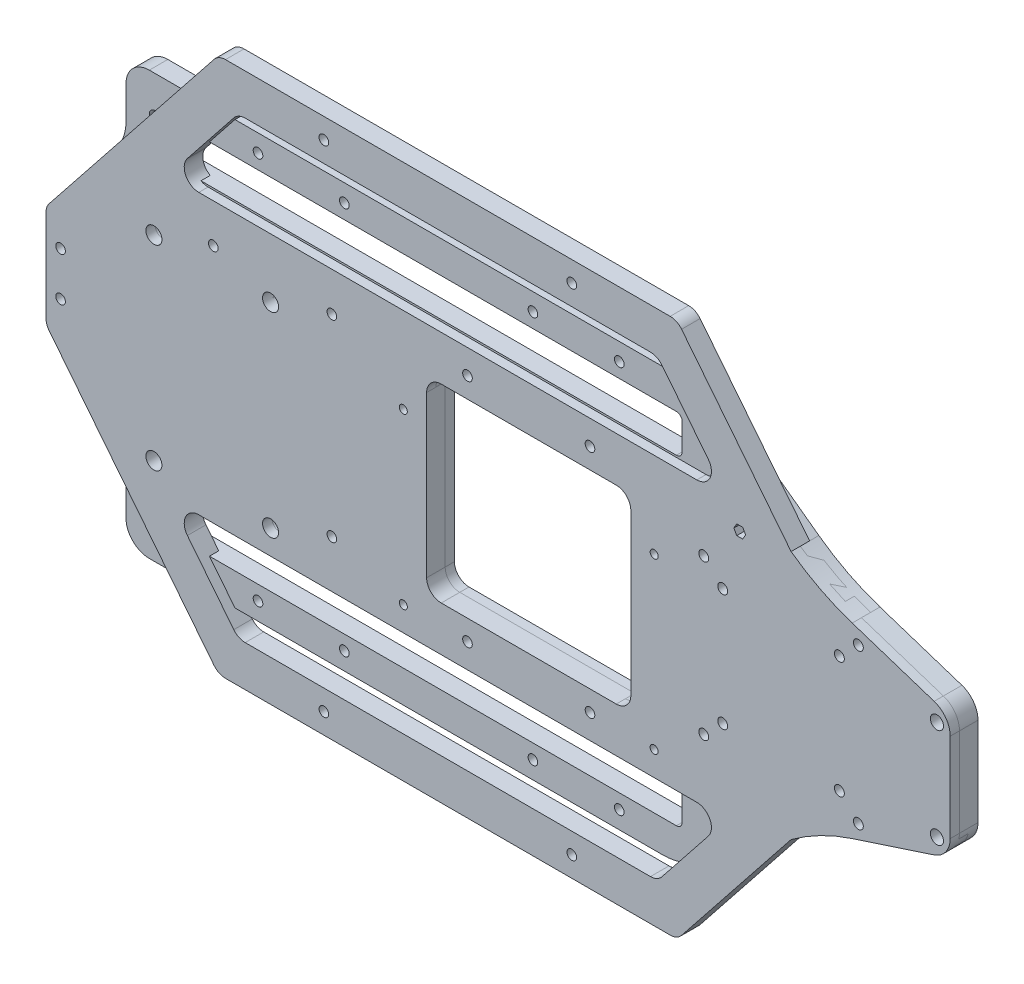
from build123d import *

# Parameters (mm, degrees)
SKETCH2_W                    = 310
SKETCH2_H                    = 145
BASE_DEPTH                   = 3.175
OUTLINE_START                = -3.175
OUTLINE_CUT_DEPTH            = 6.35
M3_MOUNTING_HOLES_DEPTH      = 172.147102298
M3_MOUNTING_HOLES_DEPTH_BACK = 172.147102298
SKETCH20_R                   = 2.25
SKETCH20_R_2                 = 1.65
FILLET2_R                    = 15
FILLET1_R                    = 8
WIRE_SLOTS_DEPTH             = 172.147102298
WIRE_SLOTS_DEPTH_BACK        = 172.147102298
ANTENNA_DEPTH                = 172.147102298
ANTENNA_DEPTH_BACK           = 172.147102298
SKETCH3_R                    = 1.65
M5_VESC_HOLES_D              = 5.5
POWERBOARD_DEPTH             = 172.147102298
POWERBOARD_DEPTH_BACK        = 172.147102298
SKETCH7_R                    = 1.65
M3_CLEARANCE_HOLE1_D         = 3.4
XAVIER_DEPTH                 = 172.147102298
XAVIER_DEPTH_BACK            = 172.147102298
XAVIER_OUTLINE_R             = 1.375
TX2_DEPTH                    = 172.147102298
TX2_DEPTH_BACK               = 172.147102298
SKETCH30_R                   = 1.65
WIRE_SLOT_DEPTH              = 172.147102298
WIRE_SLOT_DEPTH_BACK         = 172.147102298
TOP_MARKER_DEPTH             = 172.147102298
TOP_MARKER_DEPTH_BACK        = 172.147102298
SKETCH31_R                   = 1.65
SKETCH31_R_2                 = 1.7
SKETCH31_R_3                 = 1.375
SKETCH31_R_4                 = 2.75
SKETCH31_R_5                 = 2.25
BOSS_EXTRUDE2_DEPTH          = 6.35


# Read off the part's stored shape, not the designer's step: Outline Cut
with BuildPart() as part:
    # Sketch2 → Base (new, symmetric)
    with BuildSketch(Plane.XY):
        Rectangle(SKETCH2_W, SKETCH2_H)
    extrude(amount=BASE_DEPTH, both=True)

    # Outline Cut outline → Outline Cut (cut)
    with BuildSketch(Plane.XY.offset(OUTLINE_START)):
        with BuildLine():
            Line((155, -72.5), (155, -21))
            Line((155, -21), (121.4, -32))
            ThreePointArc((121.4, -32), (110.500059188, -36.546882309), (100.449037969, -42.748480562))
            Line((100.449037969, -42.748480562), (65.059562446, -68.641072915))
            ThreePointArc((65.059562446, -68.641072915), (59.462026308, -71.510805589), (53.25, -72.5))
            Line((53.25, -72.5), (155, -72.5))
        make_face()
        with BuildLine():
            Line((121.4, 32), (155, 21))
            Line((155, 21), (155, 72.5))
            Line((155, 72.5), (53.25, 72.5))
            ThreePointArc((53.25, 72.5), (59.462026308, 71.510805589), (65.059562446, 68.641072915))
            Line((65.059562446, 68.641072915), (100.449037969, 42.748480562))
            ThreePointArc((100.449037969, 42.748480562), (110.500059188, 36.546882309), (121.4, 32))
        make_face()
        Polygon((-155, -72.5), (-130.75, -72.5), (-130.75, -48), (-155, -17.5), align=None)
        Polygon((-130.75, 48), (-130.75, 72.5), (-155, 72.5), (-155, 17.5), align=None)
    extrude(amount=OUTLINE_CUT_DEPTH, mode=Mode.SUBTRACT)

    # Sketch20 → M3 Mounting Holes (cut, two sides: drawn at the far end of the back side and taken through both)
    with BuildSketch(Plane.XY.offset(-M3_MOUNTING_HOLES_DEPTH_BACK)):
        with Locations((150.445978752, -17.05)):
            Circle(SKETCH20_R)
        with Locations((150.445978752, 17.05)):
            Circle(SKETCH20_R)
        with Locations((38.365720723, -66.5)):
            Circle(SKETCH20_R_2)
        with Locations((8.765720723, -66.5)):
            Circle(SKETCH20_R_2)
        with Locations((-55.884279277, -66.5)):
            Circle(SKETCH20_R_2)
        with Locations((-85.484279277, -66.5)):
            Circle(SKETCH20_R_2)
        with Locations((38.365720723, 66.5)):
            Circle(SKETCH20_R_2)
        with Locations((8.765720723, 66.5)):
            Circle(SKETCH20_R_2)
        with Locations((-55.884279277, 66.5)):
            Circle(SKETCH20_R_2)
        with Locations((-85.484279277, 66.5)):
            Circle(SKETCH20_R_2)
    extrude(amount=M3_MOUNTING_HOLES_DEPTH + M3_MOUNTING_HOLES_DEPTH_BACK, mode=Mode.SUBTRACT)

    # Fillet2
    fillet2_edges = [part.edges().sort_by_distance(p)[0] for p in [
        (-130.75, 48, 0),
        (-130.75, -48, 0),
    ]]
    fillet(fillet2_edges, radius=FILLET2_R)

    # Fillet1
    fillet1_edges = [part.edges().sort_by_distance(p)[0] for p in [
        (155, 21, 0),
        (-130.75, 72.5, 0),
        (-155, 17.5, 0),
        (-155, -17.5, 0),
        (-130.75, -72.5, 0),
        (155, -21, 0),
    ]]
    fillet(fillet1_edges, radius=FILLET1_R)

    # Sketch21 → Wire Slots (cut, two sides: drawn at the far end of the back side and taken through both)
    with BuildSketch(Plane.XY.offset(-WIRE_SLOTS_DEPTH_BACK)):
        with BuildLine():
            Line((57.93900744, 48.499999887), (-120.750000088, 48.499999887))
            ThreePointArc((-120.750000088, 48.499999887), (-122.164213651, 49.085786325), (-122.750000088, 50.499999887))
            Line((-122.750000088, 50.499999887), (-122.750000088, 59.499999887))
            ThreePointArc((-122.750000088, 59.499999887), (-122.164213651, 60.91421345), (-120.750000088, 61.499999887))
            Line((-120.750000088, 61.499999887), (57.93900744, 61.499999887))
            ThreePointArc((57.93900744, 61.499999887), (59.353221002, 60.91421345), (59.93900744, 59.499999887))
            Line((59.93900744, 59.499999887), (59.93900744, 50.499999887))
            ThreePointArc((59.93900744, 50.499999887), (59.353221002, 49.085786325), (57.93900744, 48.499999887))
        make_face()
        with BuildLine():
            Line((-122.750000088, -50.499999887), (-122.750000088, -59.499999887))
            ThreePointArc((-122.750000088, -59.499999887), (-122.164213651, -60.91421345), (-120.750000088, -61.499999887))
            Line((-120.750000088, -61.499999887), (57.93900744, -61.499999887))
            ThreePointArc((57.93900744, -61.499999887), (59.353221002, -60.91421345), (59.93900744, -59.499999887))
            Line((59.93900744, -59.499999887), (59.93900744, -50.499999887))
            ThreePointArc((59.93900744, -50.499999887), (59.353221002, -49.085786325), (57.93900744, -48.499999887))
            Line((57.93900744, -48.499999887), (-120.750000088, -48.499999887))
            ThreePointArc((-120.750000088, -48.499999887), (-122.164213651, -49.085786325), (-122.750000088, -50.499999887))
        make_face()
    extrude(amount=WIRE_SLOTS_DEPTH + WIRE_SLOTS_DEPTH_BACK, mode=Mode.SUBTRACT)

    # Sketch3 → Antenna (cut, two sides: drawn at the far end of the back side and taken through both)
    with BuildSketch(Plane.XY.offset(-ANTENNA_DEPTH_BACK)):
        with Locations((-150, 7.5)):
            Circle(SKETCH3_R)
        with Locations(Location((-150, -7.5, 0), (0, 0, 180))):
            Circle(SKETCH3_R)
    extrude(amount=ANTENNA_DEPTH + ANTENNA_DEPTH_BACK, mode=Mode.SUBTRACT)

    # M5 Vesc Holes (through all)
    with Locations(Plane.XY.offset(3.175)):
        with Locations((-118, 27.500000113), (-78, 27.500000113), (-78, -39.499999887), (-118, -39.499999887)):
            Hole(M5_VESC_HOLES_D / 2)

    # Sketch7 → Powerboard (cut, two sides: drawn at the far end of the back side and taken through both)
    with BuildSketch(Plane.XY.offset(-POWERBOARD_DEPTH_BACK)):
        with Locations((-97.64, 34.500000113)):
            Circle(SKETCH7_R)
        with Locations((-57, 34.500000113)):
            Circle(SKETCH7_R)
        with Locations((-57, -31.539999887)):
            Circle(SKETCH7_R)
    extrude(amount=POWERBOARD_DEPTH + POWERBOARD_DEPTH_BACK, mode=Mode.SUBTRACT)

    # M3 Clearance Hole1 (through all)
    with Locations(Plane.XY.offset(3.175)):
        with Locations((70.499999911, 26.5), (76.999999911, 20), (70.499999911, -26.5), (76.999999911, -20), (123.499999911, -26.5), (116.999999911, -20), (116.999999911, 20), (123.499999911, 26.5)):
            Hole(M3_CLEARANCE_HOLE1_D / 2)

    # Xavier Outline → Xavier (cut, two sides: drawn at the far end of the back side and taken through both)
    with BuildSketch(Plane.XY.offset(-XAVIER_DEPTH_BACK)):
        with Locations((-32.500000089, 18.500000113)):
            Circle(XAVIER_OUTLINE_R)
        with Locations((53.499999911, 18.500000113)):
            Circle(XAVIER_OUTLINE_R)
        with Locations((53.499999911, -39.499999887)):
            Circle(XAVIER_OUTLINE_R)
        with Locations((-32.500000089, -39.499999887)):
            Circle(XAVIER_OUTLINE_R)
    extrude(amount=XAVIER_DEPTH + XAVIER_DEPTH_BACK, mode=Mode.SUBTRACT)

    # Sketch30 → TX2 (cut, two sides: drawn at the far end of the back side and taken through both)
    with BuildSketch(Plane.XY.offset(-TX2_DEPTH_BACK)):
        with Locations((-10.500000089, 39.5)):
            Circle(SKETCH30_R)
        with Locations((31.499999911, 39.5)):
            Circle(SKETCH30_R)
        with Locations((31.499999911, -39.5)):
            Circle(SKETCH30_R)
        with Locations((-10.500000089, -39.5)):
            Circle(SKETCH30_R)
    extrude(amount=TX2_DEPTH + TX2_DEPTH_BACK, mode=Mode.SUBTRACT)

    # Sketch29 → Wire slot (cut, two sides: drawn at the far end of the back side and taken through both)
    with BuildSketch(Plane.XY.offset(-WIRE_SLOT_DEPTH_BACK)):
        with BuildLine():
            Line((40.499999911, 32.499999887), (-19.500000089, 32.499999887))
            ThreePointArc((-19.500000089, 32.499999887), (-23.035533995, 31.035533793), (-24.500000089, 27.499999887))
            Line((-24.500000089, 27.499999887), (-24.500000089, -27.499999887))
            ThreePointArc((-24.500000089, -27.499999887), (-23.035533995, -31.035533793), (-19.500000089, -32.499999887))
            Line((-19.500000089, -32.499999887), (40.499999911, -32.499999887))
            ThreePointArc((40.499999911, -32.499999887), (44.035533817, -31.035533793), (45.499999911, -27.499999887))
            Line((45.499999911, -27.499999887), (45.499999911, 27.499999887))
            ThreePointArc((45.499999911, 27.499999887), (44.035533817, 31.035533793), (40.499999911, 32.499999887))
        make_face()
    extrude(amount=WIRE_SLOT_DEPTH + WIRE_SLOT_DEPTH_BACK, mode=Mode.SUBTRACT)

    # Sketch28 → Top Marker (cut, two sides: drawn at the far end of the back side and taken through both)
    with BuildSketch(Plane.XY.offset(-TOP_MARKER_DEPTH_BACK)):
        Polygon((80.815984942, 39.911182953), (81.826347913, 38.161182953), (83.847073855, 38.161182953), (84.857436826, 39.911182953), (83.847073855, 41.661182953), (81.826347913, 41.661182953), align=None)
    extrude(amount=TOP_MARKER_DEPTH + TOP_MARKER_DEPTH_BACK, mode=Mode.SUBTRACT)


with BuildPart() as body_2:
    # Sketch31 → Boss-Extrude2 (new body)
    with BuildSketch(Plane.XY):
        with BuildLine():
            Line((155, 15.201244436), (155, -15.201244436))
            ThreePointArc((155, -15.201244436), (153.477362332, -19.896324544), (149.489055695, -22.804178195))
            Line((149.489055695, -22.804178195), (121.4, -32))
            ThreePointArc((121.4, -32), (110.500059188, -36.546882309), (100.449037969, -42.748480562))
            Line((100.449037969, -42.748480562), (62.902214424, -89.972320485))
            ThreePointArc((62.902214424, -89.972320485), (61.161213359, -91.363851487), (58.988498855, -91.860595811))
            Line((58.988498855, -91.860595811), (-93.464849292, -91.860595811))
            ThreePointArc((-93.464849292, -91.860595811), (-95.637563796, -91.363851487), (-97.378564861, -89.972320485))
            Line((-97.378564861, -89.972320485), (-153.913715569, -18.866254645))
            ThreePointArc((-153.913715569, -18.866254645), (-154.720623785, -17.402471438), (-155, -15.754529971))
            Line((-155, -15.754529971), (-155, 15.754529971))
            ThreePointArc((-155, 15.754529971), (-154.720623785, 17.402471438), (-153.913715569, 18.866254645))
            Line((-153.913715569, 18.866254645), (-97.378564861, 89.972320485))
            ThreePointArc((-97.378564861, 89.972320485), (-95.637563796, 91.363851487), (-93.464849292, 91.860595811))
            Line((-93.464849292, 91.860595811), (58.988498855, 91.860595811))
            ThreePointArc((58.988498855, 91.860595811), (61.161213359, 91.363851487), (62.902214424, 89.972320485))
            Line((62.902214424, 89.972320485), (100.449037969, 42.748480562))
            ThreePointArc((100.449037969, 42.748480562), (110.500059188, 36.546882309), (121.4, 32))
            Line((121.4, 32), (149.489055695, 22.804178195))
            ThreePointArc((149.489055695, 22.804178195), (153.477362332, 19.896324544), (155, 15.201244436))
        make_face()
        with Locations((-59.738175218, 84.860595811)):
            Circle(SKETCH31_R, mode=Mode.SUBTRACT)
        with Locations((25.261824782, 84.860595811)):
            Circle(SKETCH31_R, mode=Mode.SUBTRACT)
        with Locations((-10.500000089, 39.5)):
            Circle(SKETCH31_R, mode=Mode.SUBTRACT)
        with Locations((31.499999911, 39.5)):
            Circle(SKETCH31_R, mode=Mode.SUBTRACT)
        with Locations((76.999999911, 20)):
            Circle(SKETCH31_R_2, mode=Mode.SUBTRACT)
        with Locations((70.499999911, 26.5)):
            Circle(SKETCH31_R_2, mode=Mode.SUBTRACT)
        with Locations((53.499999911, 18.500000113)):
            Circle(SKETCH31_R_3, mode=Mode.SUBTRACT)
        with Locations((76.999999911, -20)):
            Circle(SKETCH31_R_2, mode=Mode.SUBTRACT)
        with Locations((70.499999911, -26.5)):
            Circle(SKETCH31_R_2, mode=Mode.SUBTRACT)
        with Locations((53.499999911, -39.499999887)):
            Circle(SKETCH31_R_3, mode=Mode.SUBTRACT)
        with Locations((31.499999911, -39.5)):
            Circle(SKETCH31_R, mode=Mode.SUBTRACT)
        with Locations((-10.500000089, -39.5)):
            Circle(SKETCH31_R, mode=Mode.SUBTRACT)
        with Locations((-32.500000089, -39.499999887)):
            Circle(SKETCH31_R_3, mode=Mode.SUBTRACT)
        with Locations((-57, -31.539999887)):
            Circle(SKETCH31_R, mode=Mode.SUBTRACT)
        with Locations((-78, -39.499999887)):
            Circle(SKETCH31_R_4, mode=Mode.SUBTRACT)
        with Locations((-118, -39.499999887)):
            Circle(SKETCH31_R_4, mode=Mode.SUBTRACT)
        with Locations((-150, -7.5)):
            Circle(SKETCH31_R, mode=Mode.SUBTRACT)
        with Locations((-150, 7.5)):
            Circle(SKETCH31_R, mode=Mode.SUBTRACT)
        with Locations((-32.500000089, 18.500000113)):
            Circle(SKETCH31_R_3, mode=Mode.SUBTRACT)
        with Locations((-57, 34.500000113)):
            Circle(SKETCH31_R, mode=Mode.SUBTRACT)
        with Locations((-97.64, 34.500000113)):
            Circle(SKETCH31_R, mode=Mode.SUBTRACT)
        with Locations((-78, 27.500000113)):
            Circle(SKETCH31_R_4, mode=Mode.SUBTRACT)
        with Locations((-118, 27.500000113)):
            Circle(SKETCH31_R_4, mode=Mode.SUBTRACT)
        with Locations((123.499999911, -26.5)):
            Circle(SKETCH31_R_2, mode=Mode.SUBTRACT)
        with Locations((150.445978752, -17.05)):
            Circle(SKETCH31_R_5, mode=Mode.SUBTRACT)
        with Locations((150.445978752, 17.05)):
            Circle(SKETCH31_R_5, mode=Mode.SUBTRACT)
        with Locations((123.499999911, 26.5)):
            Circle(SKETCH31_R_2, mode=Mode.SUBTRACT)
        with Locations((116.999999911, 20)):
            Circle(SKETCH31_R_2, mode=Mode.SUBTRACT)
        with Locations((116.999999911, -20)):
            Circle(SKETCH31_R_2, mode=Mode.SUBTRACT)
        with Locations(Location((25.261824782, -84.860595811, 0), (0, 0, 180))):
            Circle(SKETCH31_R, mode=Mode.SUBTRACT)
        with Locations(Location((-59.738175218, -84.860595811, 0), (0, 0, 180))):
            Circle(SKETCH31_R, mode=Mode.SUBTRACT)
        with BuildLine():
            Line((-86.710179949, 77.860595811), (52.233829513, 77.860595811))
            ThreePointArc((52.233829513, 77.860595811), (54.406544017, 77.363851487), (56.147545082, 75.972320485))
            Line((56.147545082, 75.972320485), (72.049184426, 55.972320485))
            ThreePointArc((72.049184426, 55.972320485), (72.638724533, 50.687881307), (68.135468857, 47.860595811))
            Line((68.135468857, 47.860595811), (-102.611819294, 47.860595811))
            ThreePointArc((-102.611819294, 47.860595811), (-107.11507497, 50.687881307), (-106.525534863, 55.972320485))
            Line((-106.525534863, 55.972320485), (-90.623895518, 75.972320485))
            ThreePointArc((-90.623895518, 75.972320485), (-88.882894453, 77.363851487), (-86.710179949, 77.860595811))
        make_face(mode=Mode.SUBTRACT)
        with BuildLine():
            Line((45.499999911, -27.499999887), (45.499999911, 27.499999887))
            ThreePointArc((45.499999911, 27.499999887), (44.035533817, 31.035533793), (40.499999911, 32.499999887))
            Line((40.499999911, 32.499999887), (-19.500000089, 32.499999887))
            ThreePointArc((-19.500000089, 32.499999887), (-23.035533995, 31.035533793), (-24.500000089, 27.499999887))
            Line((-24.500000089, 27.499999887), (-24.500000089, -27.499999887))
            ThreePointArc((-24.500000089, -27.499999887), (-23.035533995, -31.035533793), (-19.500000089, -32.499999887))
            Line((-19.500000089, -32.499999887), (40.499999911, -32.499999887))
            ThreePointArc((40.499999911, -32.499999887), (44.035533817, -31.035533793), (45.499999911, -27.499999887))
        make_face(mode=Mode.SUBTRACT)
        Polygon((83.847073855, 38.161182953), (84.857436826, 39.911182953), (83.847073855, 41.661182953), (81.826347913, 41.661182953), (80.815984942, 39.911182953), (81.826347913, 38.161182953), align=None, mode=Mode.SUBTRACT)
        with BuildLine():
            Line((-86.710179949, -77.860595811), (52.233829513, -77.860595811))
            ThreePointArc((52.233829513, -77.860595811), (54.406544017, -77.363851487), (56.147545082, -75.972320485))
            Line((56.147545082, -75.972320485), (72.049184426, -55.972320485))
            ThreePointArc((72.049184426, -55.972320485), (72.638724533, -50.687881307), (68.135468857, -47.860595811))
            Line((68.135468857, -47.860595811), (-102.611819294, -47.860595811))
            ThreePointArc((-102.611819294, -47.860595811), (-107.11507497, -50.687881307), (-106.525534863, -55.972320485))
            Line((-106.525534863, -55.972320485), (-90.623895518, -75.972320485))
            ThreePointArc((-90.623895518, -75.972320485), (-88.882894453, -77.363851487), (-86.710179949, -77.860595811))
        make_face(mode=Mode.SUBTRACT)
    extrude(amount=BOSS_EXTRUDE2_DEPTH)


solid = Compound([part.part, body_2.part])
